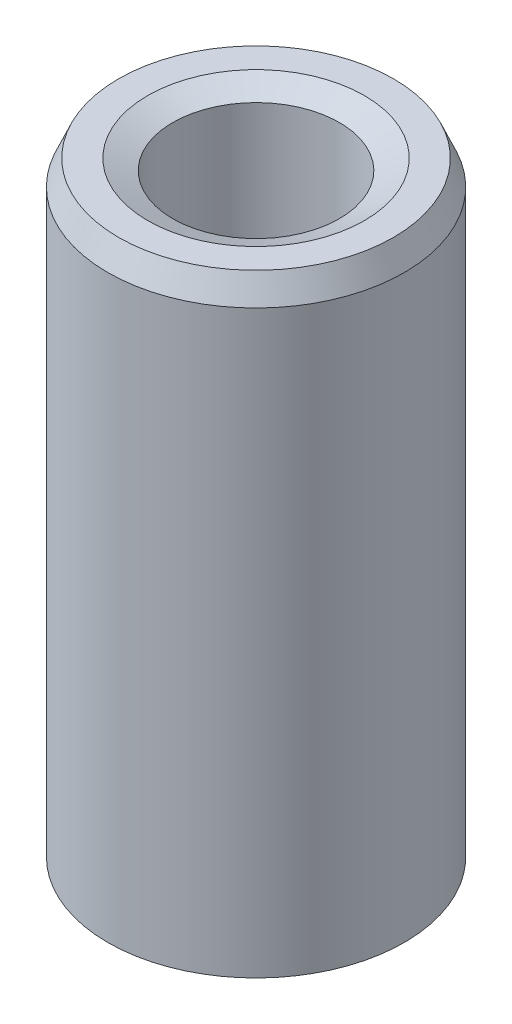
from build123d import *
from OCP.BRepFilletAPI import BRepFilletAPI_MakeChamfer

# Parameters (mm, degrees)
SKETCH1_R           = 22.5
BOSS_EXTRUDE1_DEPTH = 93.497062035
SKETCH2_R           = 12.646707212
CUT_EXTRUDE1_DEPTH  = 99.763356611
CHAMFER1_SIZE       = 3.796718447
CHAMFER1_SIZE2      = 1.642945327


with BuildPart() as part:
    # Sketch1 → Boss-Extrude1 (new body)
    with BuildSketch(Plane(origin=(0, 0, 0), x_dir=(1, 0, 0), z_dir=(0, 1, 0))):
        Circle(SKETCH1_R)
    extrude(amount=BOSS_EXTRUDE1_DEPTH)

    # Sketch2 → Cut-Extrude1 (cut, through all)
    with BuildSketch(Plane(origin=(0, 0, 0), x_dir=(1, 0, 0), z_dir=(0, 1, 0))):
        Circle(SKETCH2_R)
    extrude(amount=CUT_EXTRUDE1_DEPTH, mode=Mode.SUBTRACT)

    # Chamfer1: one chamfer whose edges measure the first distance from different faces: ONE call of the kernel's chamfer builder (chamfer() names one face for all edges)
    chamfer1_edges_1 = [part.edges().sort_by_distance(p)[0] for p in [
        (-12.646707212, 93.497062035, 0),
    ]]
    chamfer1_side_1 = [part.faces().sort_by_distance(p)[0] for p in [
        (-21.863603897, 93.497062035, 0),
    ]]
    chamfer1_edges_2 = [part.edges().sort_by_distance(p)[0] for p in [
        (-12.646707212, 0, 0),
    ]]
    chamfer1_side_2 = [part.faces().sort_by_distance(p)[0] for p in [
        (-12.646707212, 46.748531017, 0),
    ]]
    chamfer1_edges_3 = [part.edges().sort_by_distance(p)[0] for p in [
        (-22.5, 0, 0),
    ]]
    chamfer1_side_3 = [part.faces().sort_by_distance(p)[0] for p in [
        (-21.863603897, 0, 0),
    ]]
    chamfer1_edges_4 = [part.edges().sort_by_distance(p)[0] for p in [
        (-22.5, 93.497062035, 0),
    ]]
    chamfer1_side_4 = [part.faces().sort_by_distance(p)[0] for p in [
        (-22.5, 46.748531017, 0),
    ]]
    chamfer1 = BRepFilletAPI_MakeChamfer(part.part.solid().wrapped)
    for e in chamfer1_edges_1:
        chamfer1.Add(CHAMFER1_SIZE, CHAMFER1_SIZE2, e.wrapped, chamfer1_side_1[0].wrapped)  # the first distance lies on this face
    for e in chamfer1_edges_2:
        chamfer1.Add(CHAMFER1_SIZE, CHAMFER1_SIZE2, e.wrapped, chamfer1_side_2[0].wrapped)  # the first distance lies on this face
    for e in chamfer1_edges_3:
        chamfer1.Add(CHAMFER1_SIZE, CHAMFER1_SIZE2, e.wrapped, chamfer1_side_3[0].wrapped)  # the first distance lies on this face
    for e in chamfer1_edges_4:
        chamfer1.Add(CHAMFER1_SIZE, CHAMFER1_SIZE2, e.wrapped, chamfer1_side_4[0].wrapped)  # the first distance lies on this face
    add(Compound.cast(chamfer1.Shape()), mode=Mode.REPLACE)


solid = part.part
